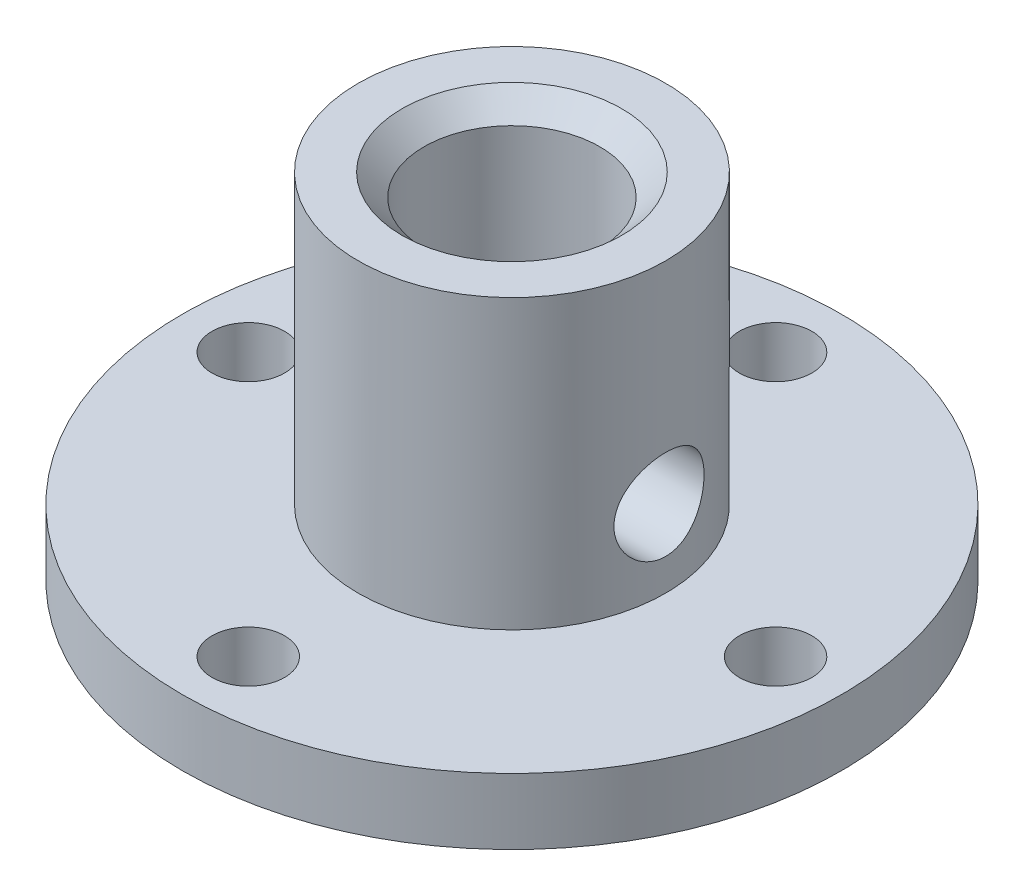
from build123d import *

# Parameters (mm, degrees)
SKETCH_1_R               = 15
SKETCH_1_R_2             = 4
EXTRUDE_1_DEPTH          = 3
SKETCH_2_R               = 7
SKETCH_2_R_2             = 4
EXTRUDE_2_DEPTH          = 13.1
CUT_EXTRUDE_1_DEPTH      = 27.630996977
CUT_EXTRUDE_1_DEPTH_BACK = 10
SKETCH_5_R               = 2.05
SKETCH_7_R               = 1.65
CUT_EXTRUDE_3_DEPTH      = 4
CHAMFER_1_SIZE           = 1


with BuildPart() as part:
    # 草图1 → 凸台-拉伸1 (new body)
    with BuildSketch(Plane(origin=(0, 0, 0), x_dir=(1, 0, 0), z_dir=(0, 1, 0))):
        with Locations(Location((0, 0, 0), (0, 0, 270))):
            Circle(SKETCH_1_R)
        with Locations(Location((0, 0, 0), (0, 0, 270))):
            Circle(SKETCH_1_R_2, mode=Mode.SUBTRACT)
    extrude(amount=EXTRUDE_1_DEPTH)

    # 草图2 → 凸台-拉伸2 (add)
    with BuildSketch(Plane(origin=(0, 3, 0), x_dir=(1, 0, 0), z_dir=(0, 1, 0))):
        with Locations(Location((0, 0, 0), (0, 0, 180))):
            Circle(SKETCH_2_R)
        with Locations(Location((0, 0, 0), (0, 0, 180))):
            Circle(SKETCH_2_R_2, mode=Mode.SUBTRACT)
    extrude(amount=EXTRUDE_2_DEPTH)

    # 草图5 → 切除-拉伸1 (cut, two sides: drawn at the far end of the back side and taken through both)
    with BuildSketch(Plane.ZY.offset(-CUT_EXTRUDE_1_DEPTH_BACK)):
        with Locations((0, 6.5)):
            Circle(SKETCH_5_R)
    extrude(amount=CUT_EXTRUDE_1_DEPTH + CUT_EXTRUDE_1_DEPTH_BACK, mode=Mode.SUBTRACT)

    # 草图7 → 切除-拉伸3 (cut)
    with BuildSketch(Plane(origin=(0, 3, 0), x_dir=(1, 0, 0), z_dir=(0, 1, 0))):
        with Locations(Location((12, 0, 0), (0, 0, 270))):
            Circle(SKETCH_7_R)
        with Locations(Location((0, -12, 0), (0, 0, 270))):
            Circle(SKETCH_7_R)
        with Locations(Location((-12, 0, 0), (0, 0, 270))):
            Circle(SKETCH_7_R)
        with Locations(Location((0, 12, 0), (0, 0, 270))):
            Circle(SKETCH_7_R)
    extrude(amount=-CUT_EXTRUDE_3_DEPTH, mode=Mode.SUBTRACT)

    # 倒角1
    # the kernel refuses this chamfer: 1 mm, written as the material it takes off along each edge
    with BuildSketch(Plane(origin=(0, 16.1, 0), x_dir=(-1, 0, 0), z_dir=(0, 0, -1))) as chamfer_1_piece_1:
        Polygon((4, -CHAMFER_1_SIZE), (4 + CHAMFER_1_SIZE, 0), (4, 0), align=None)
    revolve(axis=Axis((0, 16.1, 0), (0, 1, 0)), mode=Mode.SUBTRACT)


solid = part.part
